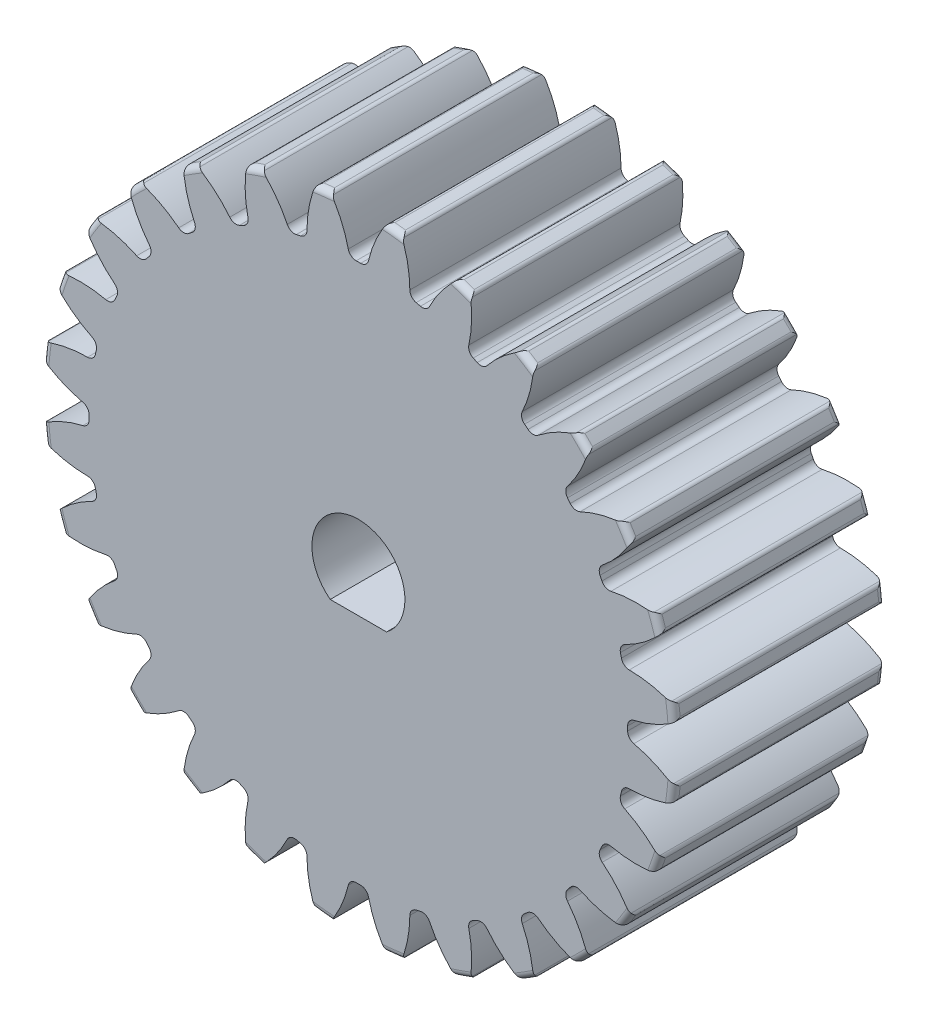
from build123d import *

# Parameters (mm, degrees)
FILLET2_R                = 0.449999999
CUT_EXTRUDE2_DEPTH       = 36.178118252
FILLET3_R                = 0.570000003
FILLET4_START            = -1
FILLET4_DEPTH            = 17
CIRPATTERN1_COUNT        = 28
FILLET3_OF_CIRPATTERN1_R = 0.570000003
CHAMFER1_SIZE            = 0.2
ESQUISSE1_R              = 18.762
ENL_V_MAT_EXTRU_1_DEPTH  = 14
ESQUISSE2_R              = 7.146747521
BOSS_EXTRU_1_DEPTH       = 15
ENL_V_MAT_EXTRU_2_DEPTH  = 36.048893767


with BuildPart() as part:
    # Sketch4 → Revolve1 (revolve)
    with BuildSketch(Plane(origin=(0, 0, 0), x_dir=(0, 0, -1), z_dir=(1, 0, 0))):
        Polygon((-29, 5.000000033), (-29, 18), (-15, 18), (-15, 22.499999958), (0, 22.499999958), (0, 5.000000033), align=None)
    revolve(axis=Axis((0, 0, 15), (0, 0, 1)))

    # Fillet2
    fillet2_edges = [part.edges().sort_by_distance(p)[0] for p in [
        (0, -22.499999958, 0),
        (0, -22.499999958, 15),
        (0, -18, 15),
        (0, -18, 29),
    ]]
    fillet(fillet2_edges, radius=FILLET2_R)

    # Sketch7 → Cut-Extrude2 (cut, through all)
    with BuildSketch(Plane.XY.offset(15)):
        with BuildLine():
            ThreePointArc((-1.974365039, 22.413207731), (0, 22.499999958), (1.974365039, 22.413207731))
            ThreePointArc((1.974365039, 22.413207731), (1.122768597, 20.83637631), (0.625042364, 19.114783318))
            ThreePointArc((0.625042364, 19.114783318), (0, 19.12499985), (-0.625042364, 19.114783318))
            ThreePointArc((-0.625042364, 19.114783318), (-1.122768597, 20.83637631), (-1.974365039, 22.413207731))
        make_face()
    cut_extrude2 = extrude(amount=-CUT_EXTRUDE2_DEPTH, mode=Mode.SUBTRACT)

    # Fillet3
    fillet3_edges = [part.edges().sort_by_distance(p)[0] for p in [
        (-0.625042364, 19.114783318, 7.5),
        (0.625042364, 19.114783318, 7.5),
    ]]
    fillet(fillet3_edges, radius=FILLET3_R)

    # Fillet4: read off the stored shape, not the designer's step
    # Fillet4 outline → Fillet4 (cut)
    with BuildSketch(Plane.XY.offset(FILLET4_START)):
        with BuildLine():
            ThreePointArc((-1.974365039, 22.413207731), (-2.059065553, 22.405585178), (-2.143736652, 22.397642538))
            ThreePointArc((-2.143736652, 22.397642538), (-1.993415831, 22.37095061), (-1.878439693, 22.270505123))
            ThreePointArc((-1.878439693, 22.270505123), (-1.926039716, 22.342105596), (-1.974365039, 22.413207731))
        make_face()
        with BuildLine():
            ThreePointArc((1.878439693, 22.270505123), (1.993415831, 22.37095061), (2.143736652, 22.397642538))
            ThreePointArc((2.143736652, 22.397642538), (2.059065553, 22.405585178), (1.974365039, 22.413207731))
            ThreePointArc((1.974365039, 22.413207731), (1.926039716, 22.342105596), (1.878439693, 22.270505123))
        make_face()
    fillet4 = extrude(amount=FILLET4_DEPTH, mode=Mode.SUBTRACT)

    # CirPattern1: Cut-Extrude2, Fillet4 ×28 about axis
    cirpattern1_axis = Axis((0, 0, 0), (0, 0, 1))
    add([cut_extrude2.rotate(cirpattern1_axis, i * 360 / CIRPATTERN1_COUNT) for i in range(1, CIRPATTERN1_COUNT)], mode=Mode.SUBTRACT)
    add([fillet4.rotate(cirpattern1_axis, i * 360 / CIRPATTERN1_COUNT) for i in range(1, CIRPATTERN1_COUNT)], mode=Mode.SUBTRACT)

    # Fillet3 of CirPattern1
    fillet3_of_cirpattern1_edges = [part.edges().sort_by_distance(p)[0] for p in [
        (-4.862810684, 18.496450782, 7.5),
        (-3.644068189, 18.774620803, 7.5),
        (-8.85673737, 16.950628968, 7.5),
        (-7.730449947, 17.493020405, 7.5),
        (-12.406550262, 14.554831839, 7.5),
        (-11.429194665, 15.334246919, 7.5),
        (-15.334246919, 11.429194665, 7.5),
        (-14.554831839, 12.406550262, 7.5),
        (-17.493020405, 7.730449947, 7.5),
        (-16.950628968, 8.85673737, 7.5),
        (-18.774620803, 3.644068189, 7.5),
        (-18.496450782, 4.862810684, 7.5),
        (-19.114783318, -0.625042364, 7.5),
        (-19.114783318, 0.625042364, 7.5),
        (-18.496450782, -4.862810684, 7.5),
        (-18.774620803, -3.644068189, 7.5),
        (-16.950628968, -8.85673737, 7.5),
        (-17.493020405, -7.730449947, 7.5),
        (-14.554831839, -12.406550262, 7.5),
        (-15.334246919, -11.429194665, 7.5),
        (-11.429194665, -15.334246919, 7.5),
        (-12.406550262, -14.554831839, 7.5),
        (-7.730449947, -17.493020405, 7.5),
        (-8.85673737, -16.950628968, 7.5),
        (-3.644068189, -18.774620803, 7.5),
        (-4.862810684, -18.496450782, 7.5),
        (0.625042364, -19.114783318, 7.5),
        (-0.625042364, -19.114783318, 7.5),
        (4.862810684, -18.496450782, 7.5),
        (3.644068189, -18.774620803, 7.5),
        (8.85673737, -16.950628968, 7.5),
        (7.730449947, -17.493020405, 7.5),
        (12.406550262, -14.554831839, 7.5),
        (11.429194665, -15.334246919, 7.5),
        (15.334246919, -11.429194665, 7.5),
        (14.554831839, -12.406550262, 7.5),
        (17.493020405, -7.730449947, 7.5),
        (16.950628968, -8.85673737, 7.5),
        (18.774620803, -3.644068189, 7.5),
        (18.496450782, -4.862810684, 7.5),
        (19.114783318, 0.625042364, 7.5),
        (19.114783318, -0.625042364, 7.5),
        (18.496450782, 4.862810684, 7.5),
        (18.774620803, 3.644068189, 7.5),
        (16.950628968, 8.85673737, 7.5),
        (17.493020405, 7.730449947, 7.5),
        (14.554831839, 12.406550262, 7.5),
        (15.334246919, 11.429194665, 7.5),
        (11.429194665, 15.334246919, 7.5),
        (12.406550262, 14.554831839, 7.5),
        (7.730449947, 17.493020405, 7.5),
        (8.85673737, 16.950628968, 7.5),
        (3.644068189, 18.774620803, 7.5),
        (4.862810684, 18.496450782, 7.5),
    ]]
    fillet(fillet3_of_cirpattern1_edges, radius=FILLET3_OF_CIRPATTERN1_R)

    # Chamfer1
    chamfer1_edges = [part.edges().sort_by_distance(p)[0] for p in [
        (0, -5.000000033, 0),
        (0, -5.000000033, 29),
    ]]
    chamfer(chamfer1_edges, length=CHAMFER1_SIZE)

    # Esquisse1 → Enlèv. mat.-Extru.1 (cut)
    with BuildSketch(Plane.XY.offset(29)):
        Circle(ESQUISSE1_R)
    extrude(amount=-ENL_V_MAT_EXTRU_1_DEPTH, mode=Mode.SUBTRACT)

    # Esquisse2 → Boss.-Extru.1 (add)
    with BuildSketch(Plane.XY.offset(15)):
        Circle(ESQUISSE2_R)
    extrude(amount=-BOSS_EXTRU_1_DEPTH)

    # Esquisse3 → Enlèv. mat.-Extru.2 (cut, through all)
    with BuildSketch(Plane.XY.offset(15)):
        with BuildLine():
            Line((-2, -2.627394908), (2, -2.627394908))
            ThreePointArc((2, -2.627394908), (0, 3.302), (-2, -2.627394908))
        make_face()
    extrude(amount=-ENL_V_MAT_EXTRU_2_DEPTH, mode=Mode.SUBTRACT)


solid = part.part
